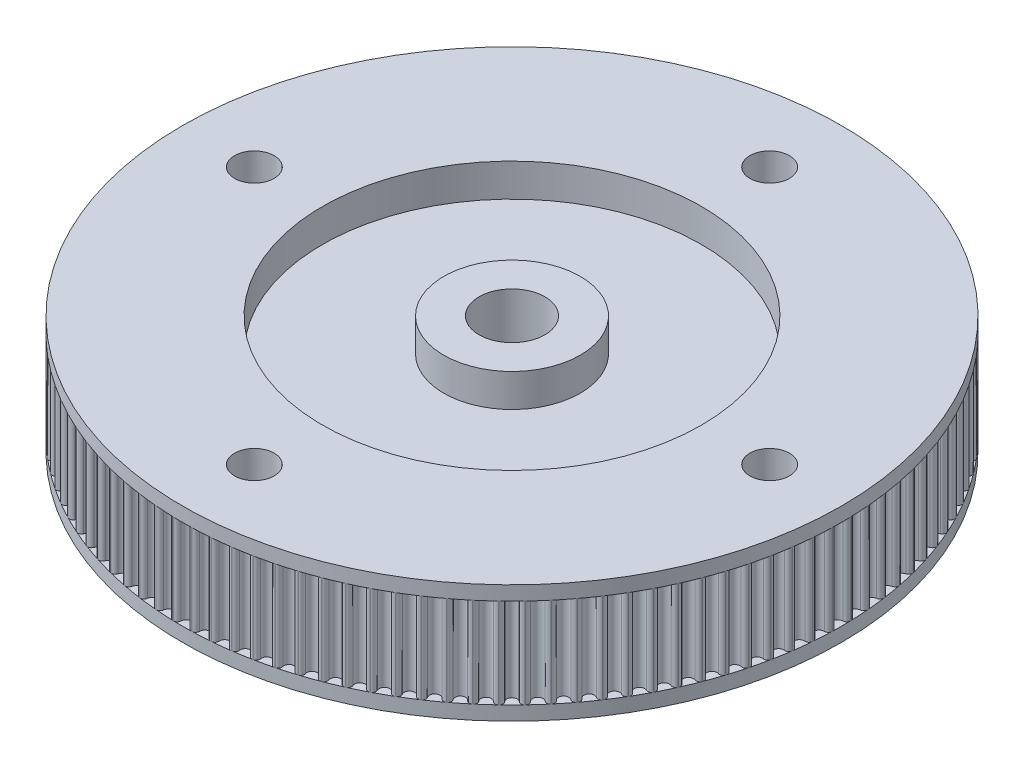
from build123d import *
from build123d.topology import SkipClean

# Parameters (mm, degrees)
CUT_EXTRUDE3_DEPTH  = 25
CIRPATTERN1_COUNT   = 112
SKETCH4_R           = 20.125
SKETCH4_R_2         = 7.25
CUT_EXTRUDE4_DEPTH  = 2
SKETCH7_R           = 2.1
CUT_EXTRUDE5_DEPTH  = 51.392236372
CIRPATTERN2_COUNT   = 4
CIRPATTERN2_ANGLE   = 270
BOSS_EXTRUDE1_START = 1.5
SKETCH8_R           = 35
SKETCH8_R_2         = 2.1
SKETCH8_R_3         = 20.125
SKETCH8_R_4         = 7.25
SKETCH8_R_5         = 3.5
BOSS_EXTRUDE1_DEPTH = 1.5


with BuildPart() as part:
    # Skica2 → Revolute (revolve)
    with BuildSketch(Plane.XY):
        Polygon((12.5, 4.775), (3.5, 4.775), (3.5, -4.775), (8.10699967, -4.775), (36, -4.775), (36, -3.775), (35, -3.775), (35, 3.775), (36, 3.775), (36, 4.775), align=None)
    revolve(axis=Axis((0, -9, 0), (0, 1, 0)))

    # Sketch2 → Cut-Extrude3 (cut, symmetric)
    with SkipClean():  # the faces are left unmerged after this step: merging them gives an invalid solid
        with BuildSketch(Plane.XZ.offset(-3.775)):
            with BuildLine():
                ThreePointArc((-0.549870829, 34.59563039), (0, 34.057549754), (0.549870829, 34.59563039))
                ThreePointArc((0.549870829, 34.59563039), (0.673966395, 34.876666046), (0.960756966, 34.98681103))
                ThreePointArc((0.960756966, 34.98681103), (1.741617328, 34.956641273), (2.521609506, 34.909045898))
                ThreePointArc((2.521609506, 34.909045898), (1.685070228, 36.378232566), (0, 36.240952722))
                ThreePointArc((0, 36.240952722), (-1.685070228, 36.378232566), (-2.521609506, 34.909045898))
                ThreePointArc((-2.521609506, 34.909045898), (-1.741617328, 34.956641273), (-0.960756966, 34.98681103))
                ThreePointArc((-0.960756966, 34.98681103), (-0.673966395, 34.876666046), (-0.549870829, 34.59563039))
            make_face()
        cut_extrude3 = extrude(amount=CUT_EXTRUDE3_DEPTH, both=True, mode=Mode.SUBTRACT)

    # CirPattern1: Cut-Extrude3 ×112 about axis
    with SkipClean():  # the faces are left unmerged after this step: merging them gives an invalid solid
        cirpattern1_axis = Axis((0, -9, 0), (0, -1, 0))
        for i in range(1, CIRPATTERN1_COUNT):
            add(cut_extrude3.rotate(cirpattern1_axis, i * 360 / CIRPATTERN1_COUNT), mode=Mode.SUBTRACT)

    # Sketch4 → Cut-Extrude4 (cut)
    with BuildSketch(Plane.XZ.offset(4.775)):
        Circle(SKETCH4_R)
        Circle(SKETCH4_R_2, mode=Mode.SUBTRACT)
    cut_extrude4 = extrude(amount=-CUT_EXTRUDE4_DEPTH, mode=Mode.SUBTRACT)

    # Mirror1: Cut-Extrude4 across plane
    add(cut_extrude4.mirror(Plane.ZX), mode=Mode.SUBTRACT)

    # Sketch7 → Cut-Extrude5 (cut, through all)
    with BuildSketch(Plane.XZ.offset(4.775)):
        with Locations((-27.366274877, 0)):
            Circle(SKETCH7_R)
    cut_extrude5 = extrude(amount=-CUT_EXTRUDE5_DEPTH, mode=Mode.SUBTRACT)

    # CirPattern2: Cut-Extrude5 ×4 about axis
    cirpattern2_axis = Axis((0, -2.775, 0), (0, -1, 0))
    for i in range(1, CIRPATTERN2_COUNT):
        add(cut_extrude5.rotate(cirpattern2_axis, i * CIRPATTERN2_ANGLE / (CIRPATTERN2_COUNT - 1)), mode=Mode.SUBTRACT)

    # Sketch8 → Boss-Extrude1 (add)
    # profile 1 of 2: a face of its own
    with BuildSketch(Plane.XZ.offset(4.775).offset(BOSS_EXTRUDE1_START)):
        Circle(SKETCH8_R)
        with Locations((0, -27.366274877)):
            Circle(SKETCH8_R_2, mode=Mode.SUBTRACT)
        with Locations((-27.366274877, 0)):
            Circle(SKETCH8_R_2, mode=Mode.SUBTRACT)
        with Locations((0, 27.366274877)):
            Circle(SKETCH8_R_2, mode=Mode.SUBTRACT)
        Circle(SKETCH8_R_3, mode=Mode.SUBTRACT)
        with Locations((27.366274877, 0)):
            Circle(SKETCH8_R_2, mode=Mode.SUBTRACT)
    # profile 2 of 2: a face of its own
    with BuildSketch(Plane.XZ.offset(4.775).offset(BOSS_EXTRUDE1_START)):
        Circle(SKETCH8_R_4)
        Circle(SKETCH8_R_5, mode=Mode.SUBTRACT)
    boss_extrude1 = extrude(amount=-BOSS_EXTRUDE1_DEPTH)

    # Mirror2: Boss-Extrude1 across plane
    add(boss_extrude1.mirror(Plane.ZX))


solid = part.part
